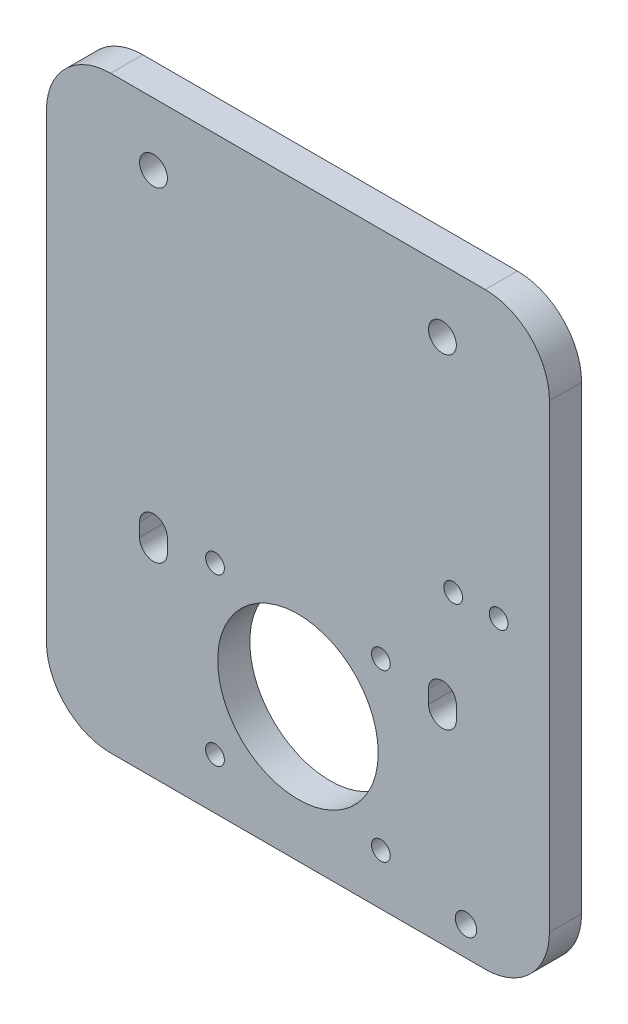
from build123d import *

# Parameters (mm, degrees)
MODEL_R            = 1.75
MODEL_R_2          = 15
MODEL_R_3          = 2.6
BASE_DEPTH         = 6
SKETCH1_R          = 1.75
CABLEMOUNT_DEPTH   = 10
SKETCH2_R          = 2
CUT_EXTRUDE1_DEPTH = 120.770614092


with BuildPart() as part:
    # Model → Base (new body)
    with BuildSketch(Plane.XY):
        with BuildLine():
            Line((47, 12), (47, 98))
            ThreePointArc((47, 98), (43.485281374, 106.485281374), (35, 110))
            Line((35, 110), (-35, 110))
            ThreePointArc((-35, 110), (-43.485281374, 106.485281374), (-47, 98))
            Line((-47, 98), (-47, 12))
            ThreePointArc((-47, 12), (-43.485281374, 3.514718626), (-35, 0))
            Line((-35, 0), (35, 0))
            ThreePointArc((35, 0), (43.485281374, 3.514718626), (47, 12))
        make_face()
        with Locations((-15.5, 9.5)):
            Circle(MODEL_R, mode=Mode.SUBTRACT)
        with BuildLine():
            Line((-29.6, 37.6), (-29.6, 40.1))
            ThreePointArc((-29.6, 40.1), (-27, 42.7), (-24.4, 40.1))
            Line((-24.4, 40.1), (-24.4, 37.6))
            ThreePointArc((-24.4, 37.6), (-27, 35), (-29.6, 37.6))
        make_face(mode=Mode.SUBTRACT)
        with Locations((-15.5, 40.5)):
            Circle(MODEL_R, mode=Mode.SUBTRACT)
        with Locations((15.5, 9.5)):
            Circle(MODEL_R, mode=Mode.SUBTRACT)
        with Locations((0, 25)):
            Circle(MODEL_R_2, mode=Mode.SUBTRACT)
        with Locations((15.5, 40.5)):
            Circle(MODEL_R, mode=Mode.SUBTRACT)
        with BuildLine():
            Line((29.6, 40.1), (29.6, 37.6))
            ThreePointArc((29.6, 37.6), (27, 35), (24.4, 37.6))
            Line((24.4, 37.6), (24.4, 40.1))
            ThreePointArc((24.4, 40.1), (27, 42.7), (29.6, 40.1))
        make_face(mode=Mode.SUBTRACT)
        with Locations((-27, 98.3)):
            Circle(MODEL_R_3, mode=Mode.SUBTRACT)
        with Locations((27, 98.3)):
            Circle(MODEL_R_3, mode=Mode.SUBTRACT)
    extrude(amount=BASE_DEPTH)

    # Sketch1 → CableMount (cut)
    with BuildSketch(Plane(origin=(0, 0, 0), x_dir=(-1, 0, 0), z_dir=(0, 0, -1))):
        with Locations((-29, 58)):
            Circle(SKETCH1_R)
        with Locations((-37.5, 58)):
            Circle(SKETCH1_R)
    extrude(amount=-CABLEMOUNT_DEPTH, mode=Mode.SUBTRACT)

    # Sketch2 → Cut-Extrude1 (cut, through all)
    with BuildSketch(Plane.XY.offset(6)):
        with Locations((31.394827987, 5.505711601)):
            Circle(SKETCH2_R)
    extrude(amount=-CUT_EXTRUDE1_DEPTH, mode=Mode.SUBTRACT)


solid = part.part
